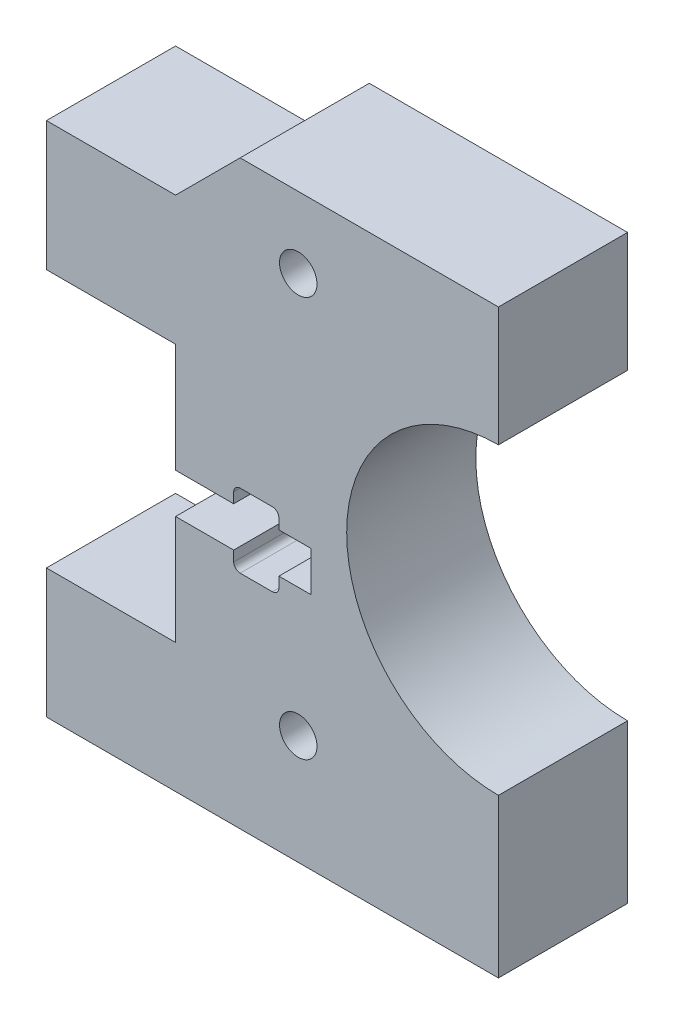
from build123d import *

# Parameters (mm, degrees)
BOSS_EXTRUDE1_DEPTH = 10
SKETCH2_R           = 11.75
SKETCH2_R_2         = 1.45
MOTOR_DEPTH         = 57.789083458
SCREW_DEPTH         = 57.789083458
SKETCH4_W           = 25
SKETCH4_H           = 5
CUT_EXTRUDE3_DEPTH  = 57.789083458


with BuildPart() as part:
    # Sketch1 → Boss-Extrude1 (new body)
    with BuildSketch(Plane.XY):
        Polygon((0, 0), (0, -5), (-10, -5), (-10, -15), (0, -15), (0, -35), (-10, -35), (-10, -45), (0, -45), (0, -50), (25, -50), (25, 0), align=None)
    extrude(amount=BOSS_EXTRUDE1_DEPTH)

    # Sketch2 → motor (cut, through all)
    with BuildSketch(Plane.XY.offset(10)):
        with Locations((25, -21)):
            Circle(SKETCH2_R)
        with Locations((9.5, -5.5)):
            Circle(SKETCH2_R_2)
        with Locations((9.5, -36.5)):
            Circle(SKETCH2_R_2)
    extrude(amount=-MOTOR_DEPTH, mode=Mode.SUBTRACT)

    # Sketch3 → screw (cut, through all)
    with BuildSketch(Plane.XY.offset(10)):
        with BuildLine():
            Line((0, -26.55), (0, -23.45))
            Line((0, -23.45), (4.5, -23.45))
            Line((4.5, -23.45), (4.5, -22.65))
            ThreePointArc((4.5, -22.65), (4.646446609, -22.296446609), (5, -22.15))
            Line((5, -22.15), (7.5, -22.15))
            ThreePointArc((7.5, -22.15), (7.853553391, -22.296446609), (8, -22.65))
            Line((8, -22.65), (8, -23.45))
            Line((8, -23.45), (10.5, -23.45))
            Line((10.5, -23.45), (10.5, -26.55))
            Line((10.5, -26.55), (8, -26.55))
            Line((8, -26.55), (8, -27.35))
            ThreePointArc((8, -27.35), (7.853553391, -27.703553391), (7.5, -27.85))
            Line((7.5, -27.85), (5, -27.85))
            ThreePointArc((5, -27.85), (4.646446609, -27.703553391), (4.5, -27.35))
            Line((4.5, -27.35), (4.5, -26.55))
            Line((4.5, -26.55), (0, -26.55))
        make_face()
    extrude(amount=-SCREW_DEPTH, mode=Mode.SUBTRACT)

    # Sketch4 → Cut-Extrude3 (cut, through all)
    with BuildSketch(Plane.XY.offset(10)):
        with Locations((12.5, -47.5)):
            Rectangle(SKETCH4_W, SKETCH4_H)
        Polygon((0, -5), (5, 0), (0, 0), align=None)
    extrude(amount=-CUT_EXTRUDE3_DEPTH, mode=Mode.SUBTRACT)


solid = part.part
